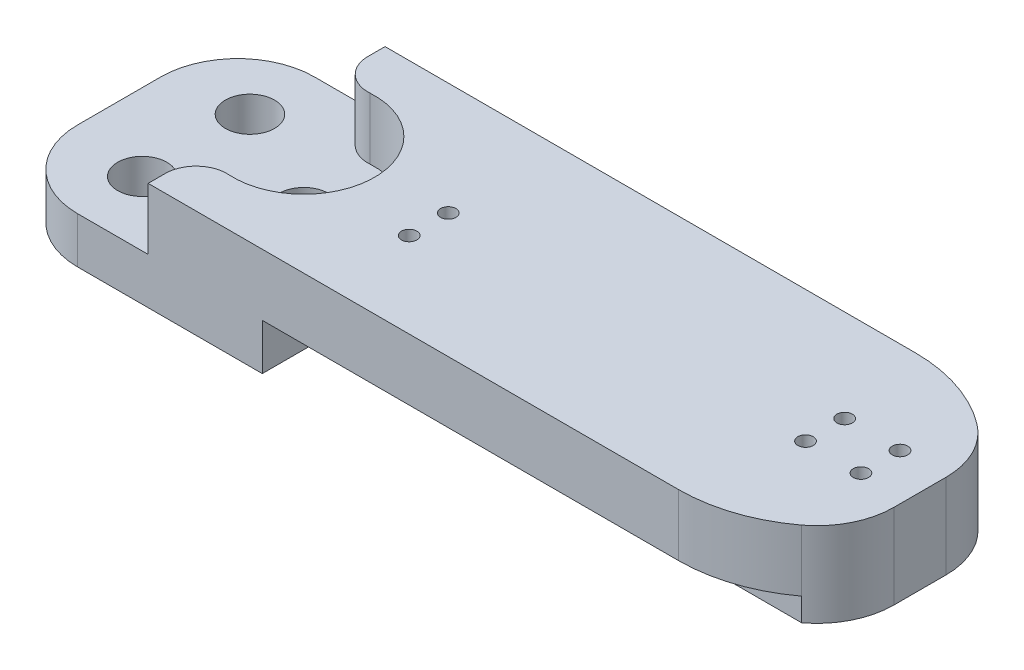
from build123d import *

# Parameters (mm, degrees)
SKETCH_2_W          = 35.05
SKETCH_2_H          = 11.3952
SKETCH_2_R          = 0.6
EXTRUDE_1_DEPTH     = 1.5
SKETCH_3_W          = 39.05
SKETCH_3_H          = 15.3952
SKETCH_3_R          = 0.5
EXTRUDE_2_DEPTH     = 4
SKETCH_4_W          = 15
SKETCH_4_H          = 4
EXTRUDE_3_DEPTH     = 15.3952
SKETCH_5_W          = 17
SKETCH_5_H          = 15.3952
EXTRUDE_4_DEPTH     = 3
SKETCH_6_R          = 1.6
CUT_EXTRUDE_1_DEPTH = 157.48252797
CUT_EXTRUDE_2_DEPTH = 4
CUT_EXTRUDE_4_DEPTH = 4
FILLET_2_R          = 5
CUT_EXTRUDE_5_DEPTH = 4
FILLET_3_R          = 2
SKETCH_10_R         = 0.6
CUT_EXTRUDE_6_DEPTH = 2
CUT_EXTRUDE_7_DEPTH = 157.422605654
CUT_EXTRUDE_8_DEPTH = 156.918332452
FILLET_5_R          = 5


with BuildPart() as part:
    # 草图2 → 凸台-拉伸1 (new body)
    with BuildSketch(Plane(origin=(0, 0, 0), x_dir=(1, 0, 0), z_dir=(0, 1, 0))):
        with Locations((108.28655231, 82.313447411)):
            Rectangle(SKETCH_2_W, SKETCH_2_H)
        with Locations(Location((94.76155231, 82.701047411, 0), (0, 0, 270))):
            Circle(SKETCH_2_R, mode=Mode.SUBTRACT)
        with Locations(Location((94.76155231, 80.161047411, 0), (0, 0, 270))):
            Circle(SKETCH_2_R, mode=Mode.SUBTRACT)
        with Locations(Location((119.21155231, 84.011047411, 0), (0, 0, 270))):
            Circle(SKETCH_2_R, mode=Mode.SUBTRACT)
        with Locations(Location((122.81155231, 84.011047411, 0), (0, 0, 270))):
            Circle(SKETCH_2_R, mode=Mode.SUBTRACT)
        with Locations(Location((122.81155231, 81.471047411, 0), (0, 0, 270))):
            Circle(SKETCH_2_R, mode=Mode.SUBTRACT)
        with Locations(Location((119.21155231, 81.471047411, 0), (0, 0, 270))):
            Circle(SKETCH_2_R, mode=Mode.SUBTRACT)
    extrude(amount=EXTRUDE_1_DEPTH)

    # 草图3 → 凸台-拉伸2 (add)
    with BuildSketch(Plane(origin=(0, 1.5, 0), x_dir=(1, 0, 0), z_dir=(0, 1, 0))):
        with Locations((108.28655231, 82.313447411)):
            Rectangle(SKETCH_3_W, SKETCH_3_H)
        with Locations(Location((94.76155231, 82.701047411, 0), (0, 0, 270))):
            Circle(SKETCH_3_R, mode=Mode.SUBTRACT)
        with Locations(Location((94.76155231, 80.161047411, 0), (0, 0, 270))):
            Circle(SKETCH_3_R, mode=Mode.SUBTRACT)
        with Locations(Location((119.21155231, 84.011047411, 0), (0, 0, 270))):
            Circle(SKETCH_3_R, mode=Mode.SUBTRACT)
        with Locations(Location((122.81155231, 84.011047411, 0), (0, 0, 270))):
            Circle(SKETCH_3_R, mode=Mode.SUBTRACT)
        with Locations(Location((122.81155231, 81.471047411, 0), (0, 0, 270))):
            Circle(SKETCH_3_R, mode=Mode.SUBTRACT)
        with Locations(Location((119.21155231, 81.471047411, 0), (0, 0, 270))):
            Circle(SKETCH_3_R, mode=Mode.SUBTRACT)
    extrude(amount=EXTRUDE_2_DEPTH)

    # 草图4 → 凸台-拉伸3 (add)
    with BuildSketch(Plane(origin=(0, 0, -90.011047411), x_dir=(-1, 0, 0), z_dir=(0, 0, -1))):
        with Locations((-81.26155231, 3.5)):
            Rectangle(SKETCH_4_W, SKETCH_4_H)
    extrude(amount=-EXTRUDE_3_DEPTH)

    # 草图5 → 凸台-拉伸4 (add)
    with BuildSketch(Plane.XZ.offset(-1.5)):
        with Locations((82.26155231, -82.313447411)):
            Rectangle(SKETCH_5_W, SKETCH_5_H)
    extrude(amount=EXTRUDE_4_DEPTH)

    # 草图6 → 切除-拉伸1 (cut, through all)
    with BuildSketch(Plane.XZ.offset(1.5)):
        with Locations(Location((78.76155231, -78.813447411, 0), (0, 0, 270))):
            Circle(SKETCH_6_R)
        with Locations(Location((85.76155231, -82.313447411, 0), (0, 0, 270))):
            Circle(SKETCH_6_R)
        with Locations(Location((78.76155231, -85.813447411, 0), (0, 0, 270))):
            Circle(SKETCH_6_R)
    extrude(amount=-CUT_EXTRUDE_1_DEPTH, mode=Mode.SUBTRACT)

    # 草图7 → 切除-拉伸2 (cut)
    with BuildSketch(Plane(origin=(0, 5.5, 0), x_dir=(1, 0, 0), z_dir=(0, 1, 0))):
        with BuildLine():
            ThreePointArc((83.342986542, 86.226315876), (76.648541293, 89.899421523), (75.776589998, 82.313447411))
            ThreePointArc((75.776589998, 82.313447411), (76.648541293, 74.727473299), (83.342986542, 78.400578945))
            ThreePointArc((83.342986542, 78.400578945), (90.36155231, 82.313447411), (83.342986542, 86.226315876))
        make_face()
    extrude(amount=-CUT_EXTRUDE_2_DEPTH, mode=Mode.SUBTRACT)

    # 草图8 → 切除-拉伸4 (cut)
    with BuildSketch(Plane(origin=(0, 5.5, 0), x_dir=(1, 0, 0), z_dir=(0, 1, 0))):
        with BuildLine():
            Line((76.880022549, 90.011047411), (73.76155231, 90.011047411))
            Line((73.76155231, 90.011047411), (73.76155231, 74.615847411))
            Line((73.76155231, 74.615847411), (76.880022549, 74.615847411))
            ThreePointArc((76.880022549, 74.615847411), (74.208097828, 78.160720601), (75.776589998, 82.313447411))
            ThreePointArc((75.776589998, 82.313447411), (74.208097828, 86.466174221), (76.880022549, 90.011047411))
        make_face()
    extrude(amount=-CUT_EXTRUDE_4_DEPTH, mode=Mode.SUBTRACT)

    # 圆角2
    fillet_2_edges = [part.edges().sort_by_distance(p)[0] for p in [
        (73.76155231, 0, -74.615847411),
        (73.76155231, 0, -90.011047411),
    ]]
    fillet(fillet_2_edges, radius=FILLET_2_R)

    # 草图9 → 切除-拉伸5 (cut)
    with BuildSketch(Plane(origin=(0, 5.5, 0), x_dir=(1, 0, 0), z_dir=(0, 1, 0))):
        Polygon((83.342986542, 86.226315876), (83.342986542, 90.011047411), (80.64308207, 90.011047411), align=None)
        Polygon((83.342986542, 78.400578945), (83.342986542, 74.615847411), (80.64308207, 74.615847411), align=None)
    extrude(amount=-CUT_EXTRUDE_5_DEPTH, mode=Mode.SUBTRACT)

    # 圆角3
    fillet_3_edges = [part.edges().sort_by_distance(p)[0] for p in [
        (83.342986542, 3.5, -78.400578945),
        (83.342986542, 3.5, -86.226315876),
    ]]
    fillet(fillet_3_edges, radius=FILLET_3_R)

    # 草图10 → 切除-拉伸6 (cut)
    with BuildSketch(Plane.XZ.offset(1.5)):
        with Locations(Location((81.76155231, -82.313447411, 0), (0, 0, 270))):
            Circle(SKETCH_10_R)
        with Locations(Location((85.76155231, -77.313447411, 0), (0, 0, 270))):
            Circle(SKETCH_10_R)
        with Locations(Location((85.76155231, -87.313447411, 0), (0, 0, 270))):
            Circle(SKETCH_10_R)
    extrude(amount=-CUT_EXTRUDE_6_DEPTH, mode=Mode.SUBTRACT)

    # 草图11 → 切除-拉伸7 (cut, through all)
    with BuildSketch(Plane.XZ):
        with BuildLine():
            Line((127.81155231, -74.615847411), (117.81155231, -74.615847411))
            ThreePointArc((117.81155231, -74.615847411), (120.97382997, -75.12901443), (123.811552309, -76.615847411))
            Line((123.811552309, -76.615847411), (125.81155231, -76.615847411))
            Line((125.81155231, -76.615847411), (125.81155231, -78.615847411))
            ThreePointArc((125.811552309, -78.615847411), (126.278688967, -79.295359009), (126.688253102, -80.011047411))
            ThreePointArc((126.688253102, -80.011047411), (127.249902706, -82.313447411), (126.688253102, -84.615847411))
            ThreePointArc((126.688253102, -84.615847411), (126.278688967, -85.331535812), (125.811552309, -86.011047411))
            Line((125.81155231, -86.011047411), (125.81155231, -88.011047411))
            Line((125.81155231, -88.011047411), (123.811552309, -88.011047411))
            ThreePointArc((123.811552309, -88.011047411), (120.97382997, -89.497880391), (117.81155231, -90.011047411))
            Line((117.81155231, -90.011047411), (127.81155231, -90.011047411))
            Line((127.81155231, -90.011047411), (127.811552309, -84.615847411))
            Line((127.811552309, -84.615847411), (127.811552309, -80.011047411))
            Line((127.811552309, -80.011047411), (127.81155231, -74.615847411))
        make_face()
        with BuildLine():
            Line((125.81155231, -76.615847411), (123.811552309, -76.615847411))
            ThreePointArc((123.811552309, -76.615847411), (124.882620121, -77.544779599), (125.811552309, -78.615847411))
            Line((125.81155231, -78.615847411), (125.81155231, -76.615847411))
        make_face()
        with BuildLine():
            Line((125.81155231, -88.011047411), (125.81155231, -86.011047411))
            ThreePointArc((125.811552309, -86.011047411), (124.882620121, -87.082115223), (123.811552309, -88.011047411))
            Line((123.811552309, -88.011047411), (125.81155231, -88.011047411))
        make_face()
    extrude(amount=-CUT_EXTRUDE_7_DEPTH, mode=Mode.SUBTRACT)

    # 草图12 → 切除-拉伸8 (cut, through all)
    with BuildSketch(Plane.XZ.offset(-1.5)):
        with BuildLine():
            Line((125.81155231, -78.615847411), (125.81155231, -86.011047411))
            ThreePointArc((125.81155231, -86.011047411), (126.278688967, -85.331535812), (126.688253102, -84.615847411))
            ThreePointArc((126.688253102, -84.615847411), (127.249902706, -82.313447411), (126.688253102, -80.011047411))
            ThreePointArc((126.688253102, -80.011047411), (126.278688967, -79.295359009), (125.81155231, -78.615847411))
        make_face()
    extrude(amount=-CUT_EXTRUDE_8_DEPTH, mode=Mode.SUBTRACT)

    # 圆角5
    fillet_5_edges = [part.edges().sort_by_distance(p)[0] for p in [
        (125.811552309, 2.75, -86.011047411),
        (125.811552309, 2.75, -78.615847411),
    ]]
    fillet(fillet_5_edges, radius=FILLET_5_R - 0.0001)  # a hair under: the kernel refuses the full size


solid = part.part
